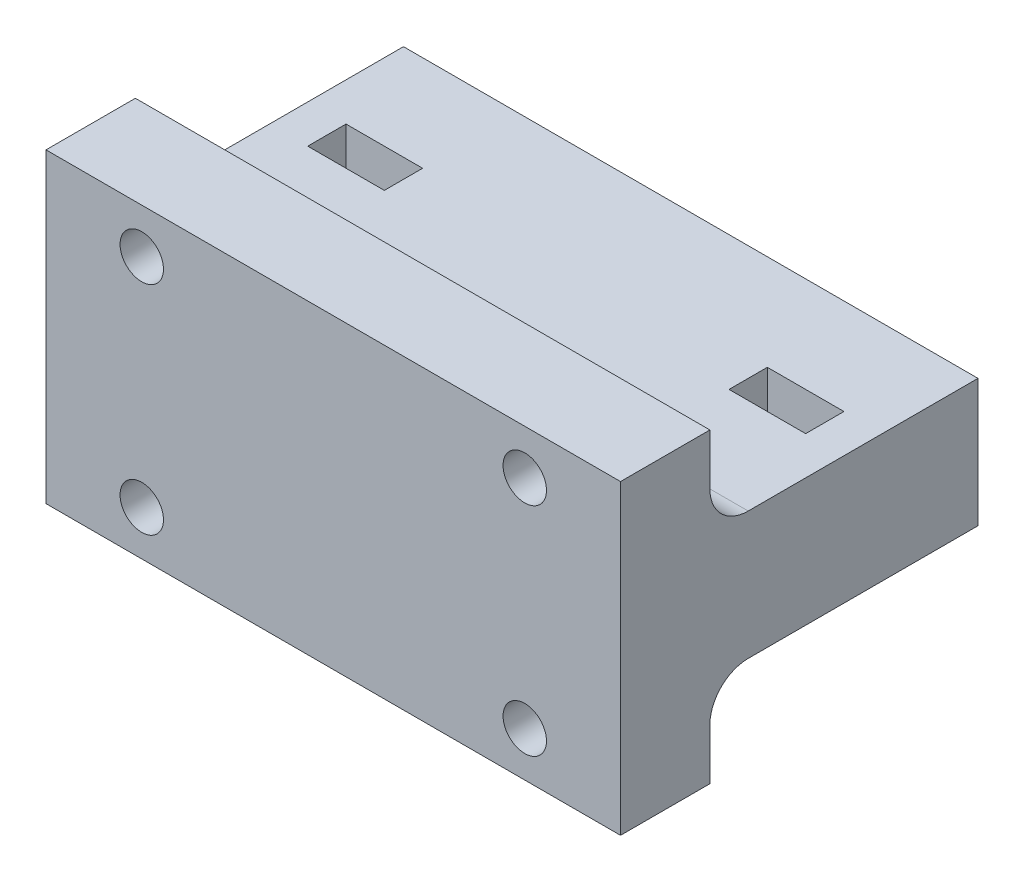
from build123d import *

# Parameters (mm, degrees)
SKETCH_1_W          = 45
SKETCH_1_H          = 20
EXTRUDE_1_DEPTH     = 10
EXTRUDE_2_DEPTH     = 17
SKETCH_3_W          = 45
SKETCH_3_H          = 2
EXTRUDE_3_DEPTH     = 10
SKETCH_5_R          = 1.5
CUT_EXTRUDE_1_DEPTH = 31.647185841
CUT_EXTRUDE_3_DEPTH = 3
FILLET_4_R          = 3
FILLET_5_R          = 3
SKETCH_9_W          = 45
SKETCH_9_H          = 24
CUT_EXTRUDE_4_DEPTH = 3
SKETCH_10_W         = 45
SKETCH_10_H         = 10
EXTRUDE_4_DEPTH     = 3
SKETCH_12_R         = 1.55
CUT_EXTRUDE_5_DEPTH = 15
CUT_EXTRUDE_6_DEPTH = 8
EXTRUDE_START       = 1
SKETCH_15_W         = 45
SKETCH_15_H         = 10
SKETCH_15_R         = 1.55
EXTRUDE_5_DEPTH     = 1
SKETCH_16_R         = 1.7
CUT_EXTRUDE_7_DEPTH = 38.871493237
CUT_EXTRUDE_8_DEPTH = 24
CUT_EXTRUDE_9_REACH = 39.871
SKETCH_18_R         = 1.7


with BuildPart() as part:
    # Эскиз1 → Бобышка-Вытянуть1 (new body)
    with BuildSketch(Plane.XY):
        Rectangle(SKETCH_1_W, SKETCH_1_H)
    extrude(amount=EXTRUDE_1_DEPTH)

    # Эскиз2 → Бобышка-Вытянуть2 (add)
    with BuildSketch(Plane(origin=(0, 0, 0), x_dir=(-1, 0, 0), z_dir=(0, 0, -1))):
        Polygon((-22.5, 0), (-22.5, 5), (22.5, 5), (22.5, -5), (-22.5, -5), align=None)
    extrude(amount=EXTRUDE_2_DEPTH)

    # Эскиз3 → Бобышка-Вытянуть3 (add)
    with BuildSketch(Plane.XY.offset(10)):
        with Locations((0, 11)):
            Rectangle(SKETCH_3_W, SKETCH_3_H)
        with Locations((0, -11)):
            Rectangle(SKETCH_3_W, SKETCH_3_H)
    extrude(amount=-EXTRUDE_3_DEPTH)

    # Эскиз5 → Вырез-Вытянуть1 (cut, through all)
    with BuildSketch(Plane(origin=(0, 0, 0), x_dir=(-1, 0, 0), z_dir=(0, 0, -1))):
        with Locations((-15, 8.5)):
            Circle(SKETCH_5_R)
        with Locations((15, 8.5)):
            Circle(SKETCH_5_R)
        with Locations((15, -8.5)):
            Circle(SKETCH_5_R)
        with Locations((-15, -8.5)):
            Circle(SKETCH_5_R)
    extrude(amount=-CUT_EXTRUDE_1_DEPTH, mode=Mode.SUBTRACT)

    # Эскиз8 → Вырез-Вытянуть3 (cut)
    with BuildSketch(Plane(origin=(0, 0, 0), x_dir=(-1, 0, 0), z_dir=(0, 0, -1))):
        Polygon((-11.824573519, 8.5), (-13.41228676, 11.25), (-16.58771324, 11.25), (-18.175426481, 8.5), (-16.58771324, 5.75), (-13.41228676, 5.75), align=None)
        Polygon((-13.41228676, -5.75), (-11.824573519, -8.5), (-13.41228676, -11.25), (-16.58771324, -11.25), (-18.175426481, -8.5), (-16.58771324, -5.75), align=None)
        Polygon((11.824573519, -8.5), (13.41228676, -11.25), (16.58771324, -11.25), (18.175426481, -8.5), (16.58771324, -5.75), (13.41228676, -5.75), align=None)
        Polygon((13.41228676, 5.75), (11.824573519, 8.5), (13.41228676, 11.25), (16.58771324, 11.25), (18.175426481, 8.5), (16.58771324, 5.75), align=None)
    extrude(amount=-CUT_EXTRUDE_3_DEPTH, mode=Mode.SUBTRACT)

    # Скругление4
    # the kernel refuses this fillet: 3 mm, written as the material it adds along each edge
    with BuildSketch(Plane(origin=(22.5, 5, 0), x_dir=(0, 1, 0), z_dir=(-1, 0, 0))) as fillet_4_piece_1_section:
        with BuildLine():
            CenterArc((FILLET_4_R, FILLET_4_R), FILLET_4_R, 180, 90)
            Line((0, FILLET_4_R), (0, 0))
            Line((0, 0), (FILLET_4_R, 0))
        make_face()
    fillet_4_piece_1 = extrude(amount=52.5, mode=Mode.PRIVATE)
    fillet_4_piece_1 = split(fillet_4_piece_1, bisect_by=Plane(origin=(17.590792641, 7.487384486, -0.29904688), z_dir=(0.866025403784439, -0.49999999999999944, 0)), keep=Keep.TOP, mode=Mode.PRIVATE)
    add(fillet_4_piece_1)
    with BuildSketch(Plane(origin=(30, 5, 0), x_dir=(0, 1, 0), z_dir=(-1, 0, 0))) as fillet_4_piece_2_section:
        with BuildLine():
            CenterArc((FILLET_4_R, FILLET_4_R), FILLET_4_R, 180, 90)
            Line((0, FILLET_4_R), (0, 0))
            Line((0, 0), (FILLET_4_R, 0))
        make_face()
    fillet_4_piece_2 = extrude(amount=52.5, mode=Mode.PRIVATE)
    fillet_4_piece_2 = split(fillet_4_piece_2, bisect_by=Plane(origin=(16.011289033, 4.751603986, -0.863215568), z_dir=(-0.866025403784439, 0.49999999999999944, 0)), keep=Keep.TOP, mode=Mode.PRIVATE)
    fillet_4_piece_2 = split(fillet_4_piece_2, bisect_by=Plane(origin=(15, 5.75, -0.863215568), z_dir=(0, -1, 0)), keep=Keep.TOP, mode=Mode.PRIVATE)
    add(fillet_4_piece_2)
    with BuildSketch(Plane(origin=(30, 5, 0), x_dir=(0, 1, 0), z_dir=(-1, 0, 0))) as fillet_4_piece_3_section:
        with BuildLine():
            CenterArc((FILLET_4_R, FILLET_4_R), FILLET_4_R, 180, 90)
            Line((0, FILLET_4_R), (0, 0))
            Line((0, 0), (FILLET_4_R, 0))
        make_face()
    fillet_4_piece_3 = extrude(amount=60, mode=Mode.PRIVATE)
    fillet_4_piece_3 = split(fillet_4_piece_3, bisect_by=Plane(origin=(9.828179478, 11.957855912, -0.295719997), z_dir=(-0.8660254037844385, -0.5000000000000003, 0)), keep=Keep.TOP, mode=Mode.PRIVATE)
    fillet_4_piece_3 = split(fillet_4_piece_3, bisect_by=Plane(origin=(-9.828179478, 11.957855912, -0.295719997), z_dir=(0.8660254037844385, -0.5000000000000003, 0)), keep=Keep.TOP, mode=Mode.PRIVATE)
    add(fillet_4_piece_3)
    with BuildSketch(Plane(origin=(30, 5, 0), x_dir=(0, 1, 0), z_dir=(-1, 0, 0))) as fillet_4_piece_4_section:
        with BuildLine():
            CenterArc((FILLET_4_R, FILLET_4_R), FILLET_4_R, 180, 90)
            Line((0, FILLET_4_R), (0, 0))
            Line((0, 0), (FILLET_4_R, 0))
        make_face()
    fillet_4_piece_4 = extrude(amount=52.5, mode=Mode.PRIVATE)
    fillet_4_piece_4 = split(fillet_4_piece_4, bisect_by=Plane(origin=(-17.590792641, 7.487384486, -0.29904688), z_dir=(-0.866025403784439, -0.49999999999999944, 0)), keep=Keep.TOP, mode=Mode.PRIVATE)
    add(fillet_4_piece_4)

    # Скругление5
    # the kernel refuses this fillet: 3 mm, written as the material it adds along each edge
    with BuildSketch(Plane(origin=(-22.5, -5, 0), x_dir=(0, 0, -1), z_dir=(1, 0, 0))) as fillet_5_piece_1_section:
        with BuildLine():
            CenterArc((FILLET_5_R, -FILLET_5_R), FILLET_5_R, 90, 90)
            Line((0, -FILLET_5_R), (0, 0))
            Line((0, 0), (FILLET_5_R, 0))
        make_face()
    fillet_5_piece_1 = extrude(amount=45, mode=Mode.PRIVATE)
    fillet_5_piece_1 = split(fillet_5_piece_1, bisect_by=Plane(origin=(-19.417241341, -5.75, -0.889716038), z_dir=(0, 1, 0)), keep=Keep.TOP, mode=Mode.PRIVATE)
    add(fillet_5_piece_1)
    with BuildSketch(Plane(origin=(-22.5, -5, 0), x_dir=(0, 0, -1), z_dir=(1, 0, 0))) as fillet_5_piece_2_section:
        with BuildLine():
            CenterArc((FILLET_5_R, -FILLET_5_R), FILLET_5_R, 90, 90)
            Line((0, -FILLET_5_R), (0, 0))
            Line((0, 0), (FILLET_5_R, 0))
        make_face()
    fillet_5_piece_2 = extrude(amount=52.5, mode=Mode.PRIVATE)
    fillet_5_piece_2 = split(fillet_5_piece_2, bisect_by=Plane(origin=(-17.590792641, -7.487384486, -0.29904688), z_dir=(-0.866025403784439, 0.49999999999999944, 0)), keep=Keep.TOP, mode=Mode.PRIVATE)
    add(fillet_5_piece_2)
    with BuildSketch(Plane(origin=(-30, -5, 0), x_dir=(0, 0, -1), z_dir=(1, 0, 0))) as fillet_5_piece_3_section:
        with BuildLine():
            CenterArc((FILLET_5_R, -FILLET_5_R), FILLET_5_R, 90, 90)
            Line((0, -FILLET_5_R), (0, 0))
            Line((0, 0), (FILLET_5_R, 0))
        make_face()
    fillet_5_piece_3 = extrude(amount=60, mode=Mode.PRIVATE)
    fillet_5_piece_3 = split(fillet_5_piece_3, bisect_by=Plane(origin=(-9.828179478, -11.957855912, -0.295719997), z_dir=(0.8660254037844385, 0.5000000000000003, 0)), keep=Keep.TOP, mode=Mode.PRIVATE)
    fillet_5_piece_3 = split(fillet_5_piece_3, bisect_by=Plane(origin=(9.828179478, -11.957855912, -0.295719997), z_dir=(-0.8660254037844385, 0.5000000000000003, 0)), keep=Keep.TOP, mode=Mode.PRIVATE)
    add(fillet_5_piece_3)
    with BuildSketch(Plane(origin=(-30, -5, 0), x_dir=(0, 0, -1), z_dir=(1, 0, 0))) as fillet_5_piece_4_section:
        with BuildLine():
            CenterArc((FILLET_5_R, -FILLET_5_R), FILLET_5_R, 90, 90)
            Line((0, -FILLET_5_R), (0, 0))
            Line((0, 0), (FILLET_5_R, 0))
        make_face()
    fillet_5_piece_4 = extrude(amount=52.5, mode=Mode.PRIVATE)
    fillet_5_piece_4 = split(fillet_5_piece_4, bisect_by=Plane(origin=(17.590792641, -7.487384486, -0.29904688), z_dir=(0.866025403784439, 0.49999999999999944, 0)), keep=Keep.TOP, mode=Mode.PRIVATE)
    add(fillet_5_piece_4)

    # Эскиз9 → Вырез-Вытянуть4 (cut)
    with BuildSketch(Plane.XY.offset(10)):
        Rectangle(SKETCH_9_W, SKETCH_9_H)
    extrude(amount=-CUT_EXTRUDE_4_DEPTH, mode=Mode.SUBTRACT)

    # Эскиз10 → Бобышка-Вытянуть4 (add)
    with BuildSketch(Plane(origin=(0, 0, -17), x_dir=(-1, 0, 0), z_dir=(0, 0, -1))):
        Rectangle(SKETCH_10_W, SKETCH_10_H)
    extrude(amount=EXTRUDE_4_DEPTH)

    # Эскиз12 → Вырез-Вытянуть5 (cut)
    with BuildSketch(Plane(origin=(0, 0, -20), x_dir=(-1, 0, 0), z_dir=(0, 0, -1))):
        with Locations((-16.5, 0)):
            Circle(SKETCH_12_R)
        with Locations((16.5, 0)):
            Circle(SKETCH_12_R)
    extrude(amount=-CUT_EXTRUDE_5_DEPTH, mode=Mode.SUBTRACT)

    # Эскиз13 → Вырез-Вытянуть6 (cut)
    with BuildSketch(Plane(origin=(0, 5, 0), x_dir=(1, 0, 0), z_dir=(0, 1, 0))):
        Polygon((16.5, 13.5), (13.5, 13.5), (13.5, 10.5), (19.5, 10.5), (19.5, 13.5), align=None)
        Polygon((-19.5, 13.5), (-16.5, 13.5), (-13.5, 13.5), (-13.5, 10.5), (-19.5, 10.5), align=None)
    extrude(amount=-CUT_EXTRUDE_6_DEPTH, mode=Mode.SUBTRACT)

    # Эскиз15 → Бобышка-Вытянуть5 (add)
    with BuildSketch(Plane(origin=(0, 0, -20), x_dir=(-1, 0, 0), z_dir=(0, 0, -1)).offset(EXTRUDE_START)):
        Rectangle(SKETCH_15_W, SKETCH_15_H)
        with Locations((-16.5, 0)):
            Circle(SKETCH_15_R, mode=Mode.SUBTRACT)
        with Locations((16.5, 0)):
            Circle(SKETCH_15_R, mode=Mode.SUBTRACT)
    extrude(amount=-EXTRUDE_5_DEPTH)

    # Эскиз16 → Вырез-Вытянуть7 (cut, through all)
    with BuildSketch(Plane.XY.offset(7)):
        with Locations((15, -8.5)):
            Circle(SKETCH_16_R)
        with Locations((-15, -8.5)):
            Circle(SKETCH_16_R)
        with Locations((-15, 8.5)):
            Circle(SKETCH_16_R)
        with Locations((15, 8.5)):
            Circle(SKETCH_16_R)
    extrude(amount=-CUT_EXTRUDE_7_DEPTH, mode=Mode.SUBTRACT)

    # Эскиз17 → Вырез-Вытянуть8 (cut)
    with BuildSketch(Plane(origin=(0, 0, -21), x_dir=(-1, 0, 0), z_dir=(0, 0, -1))):
        Polygon((-13.296816706, 5.55), (-11.593633412, 8.5), (-13.296816706, 11.45), (-16.703183294, 11.45), (-18.406366588, 8.5), (-16.703183294, 5.55), align=None)
        Polygon((16.703183294, 5.55), (18.406366588, 8.5), (16.703183294, 11.45), (13.296816706, 11.45), (11.593633412, 8.5), (13.296816706, 5.55), align=None)
        Polygon((16.703183294, -11.45), (18.406366588, -8.5), (16.703183294, -5.55), (13.296816706, -5.55), (11.593633412, -8.5), (13.296816706, -11.45), align=None)
        Polygon((-13.296816706, -11.45), (-11.593633412, -8.5), (-13.296816706, -5.55), (-16.703183294, -5.55), (-18.406366588, -8.5), (-16.703183294, -11.45), align=None)
    extrude(amount=-CUT_EXTRUDE_8_DEPTH, mode=Mode.SUBTRACT)

    # Вырез-Вытянуть9: up to this face of the body (flat: up to its plane)
    cut_extrude_9_end = Plane(part.part.faces().sort_by_distance((16.5, 0, -5))[0])
    # Эскиз18 → Вырез-Вытянуть9 (cut, up to the picked face)
    with BuildSketch(Plane(origin=(0, 0, -21), x_dir=(-1, 0, 0), z_dir=(0, 0, -1)), mode=Mode.PRIVATE) as cut_extrude_9_sk1:
        with Locations((-16.5, 0)):
            Circle(SKETCH_18_R)
    cut_extrude_9_tool1 = split(extrude(cut_extrude_9_sk1.sketch, amount=-CUT_EXTRUDE_9_REACH, mode=Mode.PRIVATE), bisect_by=cut_extrude_9_end, keep=Keep.BOTH, mode=Mode.PRIVATE)
    # Эскиз18 → Вырез-Вытянуть9 (cut, up to the picked face)
    with BuildSketch(Plane(origin=(0, 0, -21), x_dir=(-1, 0, 0), z_dir=(0, 0, -1)), mode=Mode.PRIVATE) as cut_extrude_9_sk2:
        with Locations((16.5, 0)):
            Circle(SKETCH_18_R)
    cut_extrude_9_tool2 = split(extrude(cut_extrude_9_sk2.sketch, amount=-CUT_EXTRUDE_9_REACH, mode=Mode.PRIVATE), bisect_by=cut_extrude_9_end, keep=Keep.BOTH, mode=Mode.PRIVATE)
    add(cut_extrude_9_tool1.solids().sort_by(Axis((16.5, 0, -21), (0, 0, 1)))[0], mode=Mode.SUBTRACT)
    add(cut_extrude_9_tool2.solids().sort_by(Axis((-16.5, 0, -21), (0, 0, 1)))[0], mode=Mode.SUBTRACT)


solid = part.part
